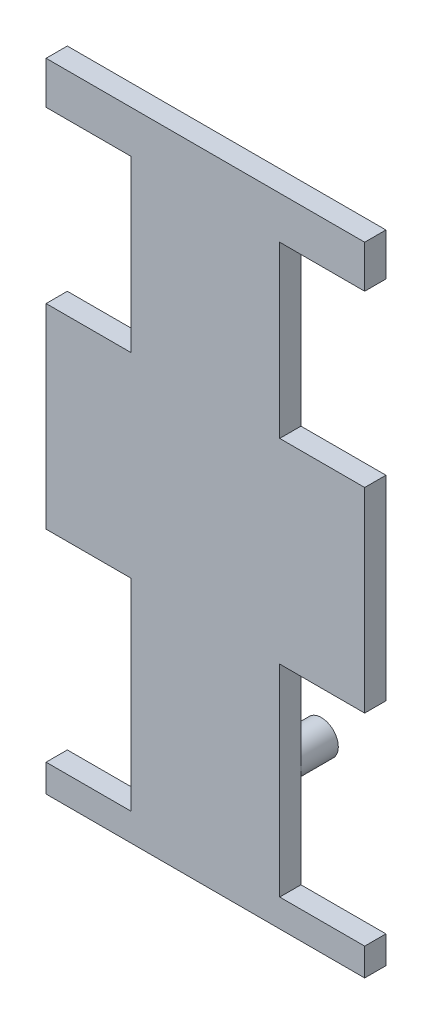
from build123d import *

# Parameters (mm, degrees)
BOSS_EXTRUDE1_DEPTH = 10
SKETCH5_R           = 8
BOSS_EXTRUDE3_DEPTH = 18
SKETCH6_W           = 40
SKETCH6_H           = 8
SKETCH6_H_2         = 7
CUT_EXTRUDE1_DEPTH  = 336.892840055


with BuildPart() as part:
    # Sketch2 → Boss-Extrude1 (new body)
    with BuildSketch(Plane.XY):
        Polygon((0, 0), (-150, 0), (-150, 20), (-110, 20), (-110, 100), (-150, 100), (-150, 200), (-110, 200), (-110, 280), (-150, 280), (-150, 300), (0, 300), (0, 280), (-40, 280), (-40, 200), (0, 200), (0, 100), (-40, 100), (-40, 20), (0, 20), align=None)
    extrude(amount=BOSS_EXTRUDE1_DEPTH)

    # Sketch5 → Boss-Extrude3 (add)
    with BuildSketch(Plane(origin=(0, 0, 0), x_dir=(-1, 0, 0), z_dir=(0, 0, -1))):
        with Locations((48.421647856, 60)):
            Circle(SKETCH5_R)
        with Locations((101.578352144, 60)):
            Circle(SKETCH5_R)
    extrude(amount=BOSS_EXTRUDE3_DEPTH)

    # Sketch6 → Cut-Extrude1 (cut, through all)
    with BuildSketch(Plane(origin=(0, 0, 0), x_dir=(-1, 0, 0), z_dir=(0, 0, -1))):
        with Locations((20, 104)):
            Rectangle(SKETCH6_W, SKETCH6_H)
        with Locations((130, 104)):
            Rectangle(SKETCH6_W, SKETCH6_H)
        with Locations((20, 16.5)):
            Rectangle(SKETCH6_W, SKETCH6_H_2)
        with Locations((130, 16.5)):
            Rectangle(SKETCH6_W, SKETCH6_H_2)
    extrude(amount=-CUT_EXTRUDE1_DEPTH, mode=Mode.SUBTRACT)


solid = part.part
